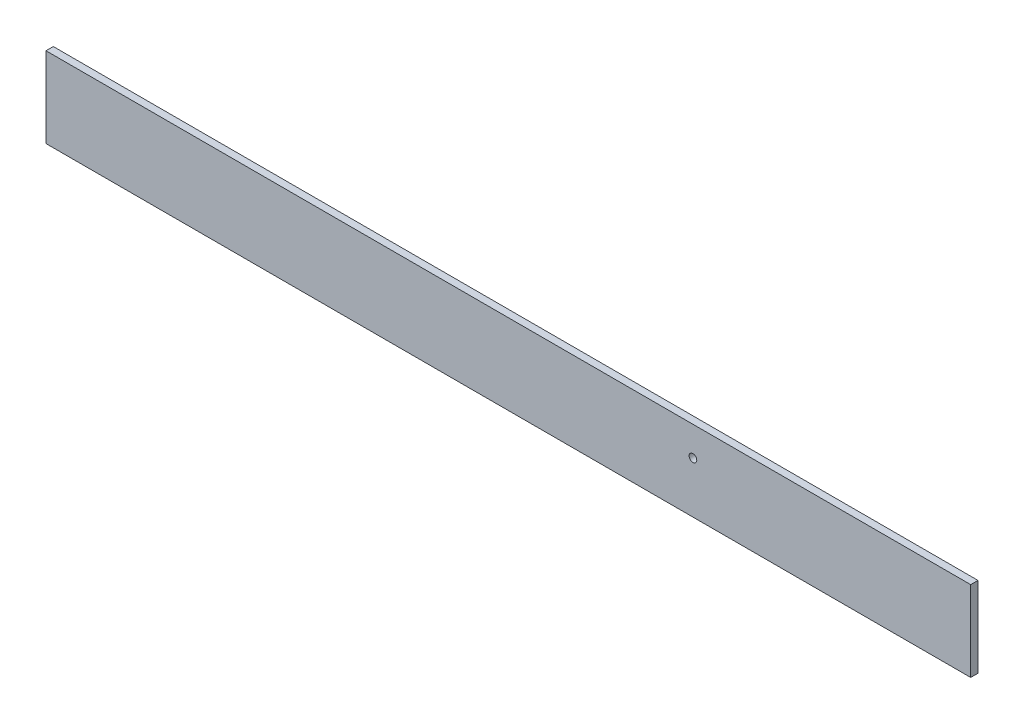
from build123d import *

# Parameters (mm, degrees)
SKETCH2_W           = 506
SKETCH2_H           = 44
SKETCH2_R           = 2.1
BOSS_EXTRUDE1_DEPTH = 4


with BuildPart() as part:
    # Sketch2 → Boss-Extrude1 (new body)
    with BuildSketch(Plane.XY):
        Rectangle(SKETCH2_W, SKETCH2_H)
        with Locations((101, 6)):
            Circle(SKETCH2_R, mode=Mode.SUBTRACT)
    extrude(amount=BOSS_EXTRUDE1_DEPTH)


solid = part.part
